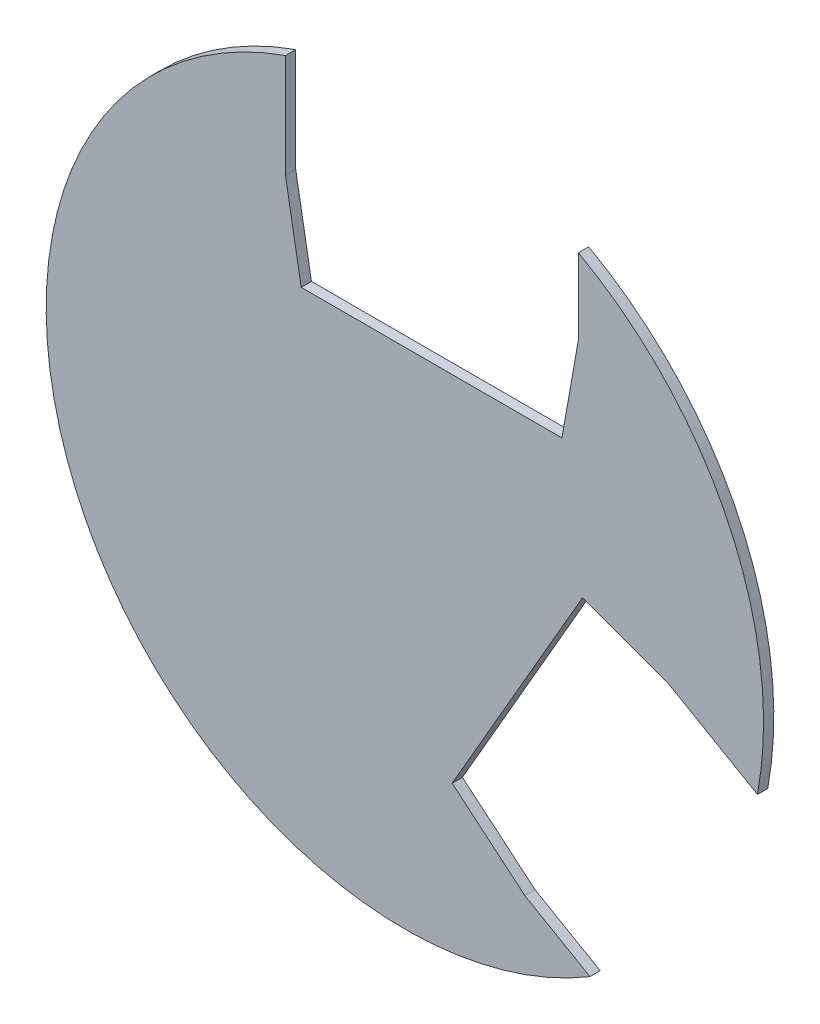
from build123d import *

# Parameters (mm, degrees)
ESQUISSE1_R             = 175
BOSS_EXTRU_1_DEPTH      = 5
ENL_V_MAT_EXTRU_1_DEPTH = 5


with BuildPart() as part:
    # Esquisse1 → Boss.-Extru.1 (new body)
    with BuildSketch(Plane.XY):
        Circle(ESQUISSE1_R)
    extrude(amount=BOSS_EXTRU_1_DEPTH)

    # Esquisse2 → Enlèv. mat.-Extru.1 (cut)
    with BuildSketch(Plane(origin=(0, 0, 0), x_dir=(-1, 0, 0), z_dir=(0, 0, -1))):
        Polygon((58.240826849, 114.332025077), (58.240826849, 213.87663255), (-84.681680643, 213.87663255), (-84.681680643, 116.513512453), (-76.636603499, 70.887612711), (50.580404788, 70.887612711), align=None)
        Polygon((-128.134851608, -6.727976949), (-214.343010489, -56.500280686), (-142.881756743, -180.274802947), (-58.562821347, -131.593242898), (-23.072171671, -101.813051845), (-86.680675815, 8.360109125), align=None)
    extrude(amount=-ENL_V_MAT_EXTRU_1_DEPTH, mode=Mode.SUBTRACT)


solid = part.part
